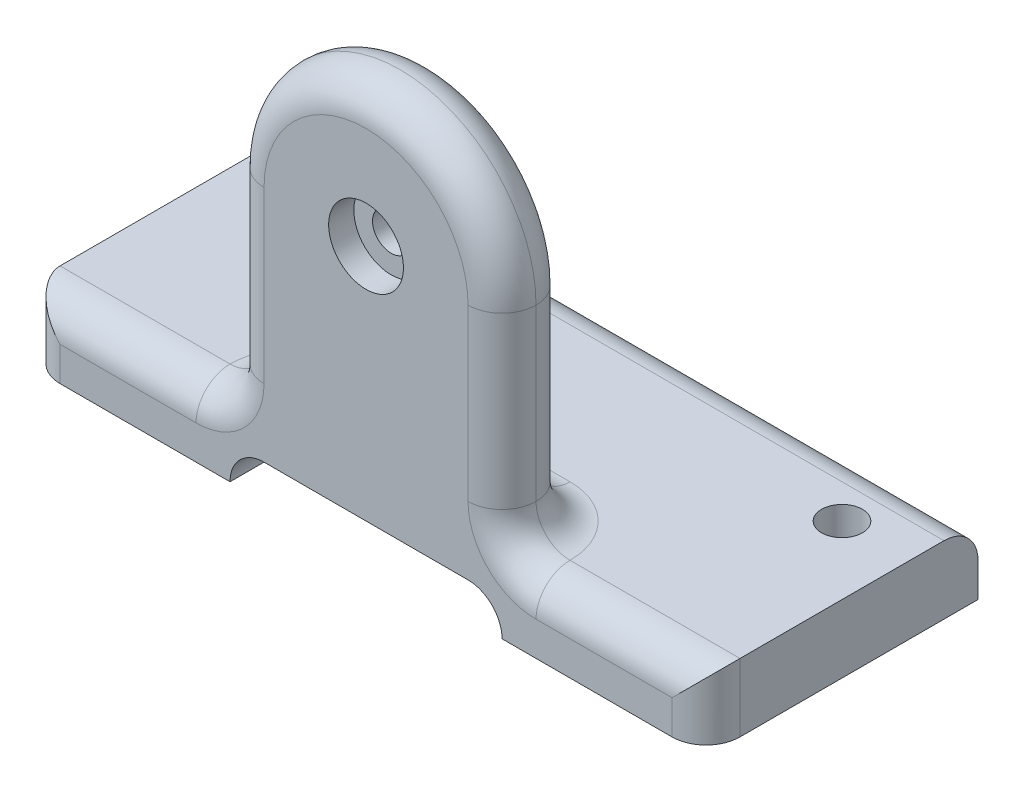
from build123d import *

# Parameters (mm, degrees)
ESBO_O1_W                                           = 100
ESBO_O1_H                                           = 40
RESSALTO_EXTRUS_O1_DEPTH                            = 10
RESSALTO_EXTRUS_O2_DEPTH                            = 10
ESBO_O3_R                                           = 3
CORTE_EXTRUS_O1_DEPTH                               = 74.484692283
REBAIXO_PARA_PARAFUSO_COM_CABE_A_PANELA_D           = 5.5
REBAIXO_PARA_PARAFUSO_COM_CABE_A_PANELA_CBORE_D     = 11
REBAIXO_PARA_PARAFUSO_COM_CABE_A_PANELA_CBORE_DEPTH = 3.7
ESBO_O6_W                                           = 40
ESBO_O6_H                                           = 5
CORTE_EXTRUS_O2_DEPTH                               = 88.749643874
FILETE1_R                                           = 5


with BuildPart() as part:
    # Esboço1 → Ressalto-extrusão1 (new body)
    with BuildSketch(Plane(origin=(0, 0, 0), x_dir=(1, 0, 0), z_dir=(0, 1, 0))):
        Rectangle(ESBO_O1_W, ESBO_O1_H)
    extrude(amount=RESSALTO_EXTRUS_O1_DEPTH)

    # Esboço2 → Ressalto-extrusão2 (add)
    with BuildSketch(Plane.XY.offset(20)):
        with BuildLine():
            Line((-20, 0), (-20, 40))
            ThreePointArc((-20, 40), (0, 60), (20, 40))
            Line((20, 40), (20, 0))
            Line((20, 0), (-20, 0))
        make_face()
    extrude(amount=-RESSALTO_EXTRUS_O2_DEPTH)

    # Esboço3 → Corte-extrusão1 (cut, through all)
    with BuildSketch(Plane(origin=(0, 10, 0), x_dir=(1, 0, 0), z_dir=(0, 1, 0))):
        with Locations(Location((-40, 10, 0), (0, 0, 270))):
            Circle(ESBO_O3_R)
        with Locations(Location((40, 10, 0), (0, 0, 270))):
            Circle(ESBO_O3_R)
    extrude(amount=-CORTE_EXTRUS_O1_DEPTH, mode=Mode.SUBTRACT)

    # Rebaixo para parafuso com cabeça panela de M51 (through all)
    with Locations(Plane(origin=(0, 40, 20), x_dir=(1, 0, 0), z_dir=(0, 0, 1))):
        with Locations((0, 0)):
            CounterBoreHole(REBAIXO_PARA_PARAFUSO_COM_CABE_A_PANELA_D / 2, REBAIXO_PARA_PARAFUSO_COM_CABE_A_PANELA_CBORE_D / 2, REBAIXO_PARA_PARAFUSO_COM_CABE_A_PANELA_CBORE_DEPTH)

    # Esboço6 → Corte-extrusão2 (cut, through all)
    with BuildSketch(Plane.XY.offset(20)):
        with Locations((0, 2.5)):
            Rectangle(ESBO_O6_W, ESBO_O6_H)
    extrude(amount=-CORTE_EXTRUS_O2_DEPTH, mode=Mode.SUBTRACT)

    # Filete1
    filete1_edges = [part.edges().sort_by_distance(p)[0] for p in [
        (-35, 10, 20),
        (35, 10, 20),
        (-20, 25, 10),
        (-20, 10, 15),
        (0, 60, 10),
        (20, 10, 15),
        (20, 25, 10),
        (0, 10, 10),
        (20, 25, 20),
        (0, 60, 20),
        (-20, 25, 20),
        (-20, 5, 0),
        (20, 5, 0),
        (0, 10, -20),
        (50, 5, 20),
        (-50, 5, 20),
    ]]
    fillet(filete1_edges, radius=FILETE1_R - 0.0001)  # a hair under: the kernel refuses the full size


solid = part.part
